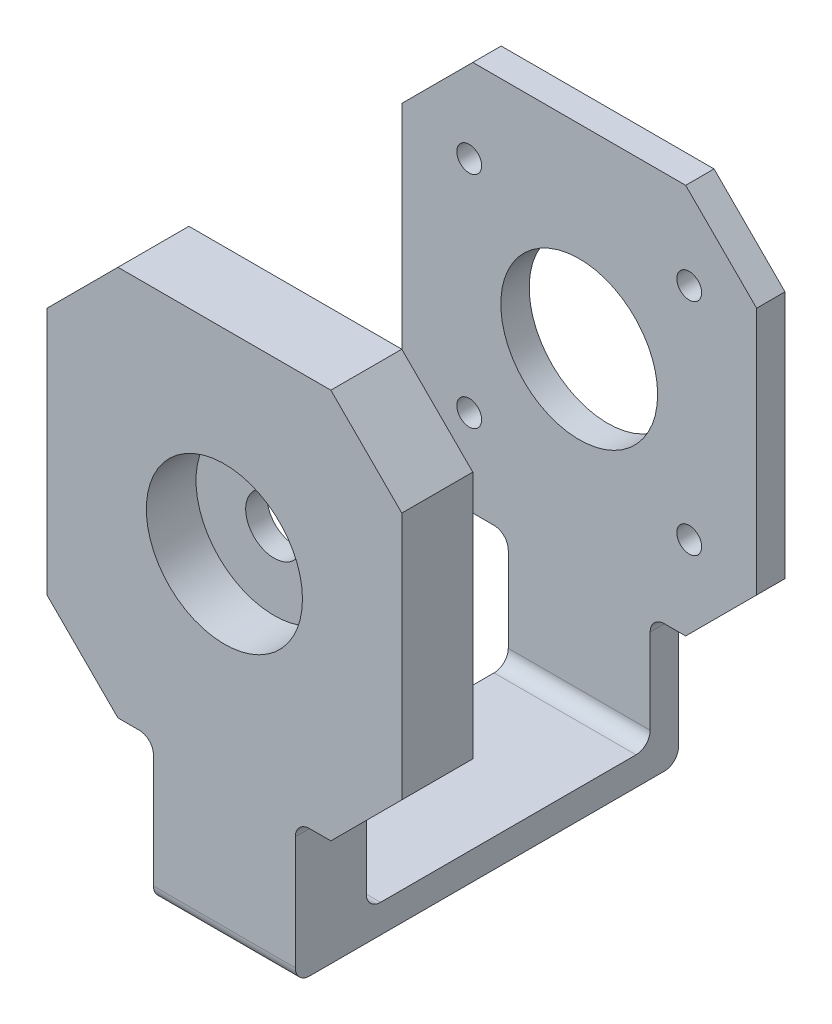
from build123d import *

# Parameters (mm, degrees)
SCHIZZO1_R                   = 1.75
SCHIZZO1_R_2                 = 11.05
ESTRUSIONE_ESTRUSIONE1_DEPTH = 4
SCHIZZO14_W                  = 20
SCHIZZO14_H                  = 4
ESTRUSIONE_ESTRUSIONE2_DEPTH = 40
ESTRUSIONE_ESTRUSIONE3_DEPTH = 10
SCHIZZO19_R                  = 11
TAGLIO_ESTRUSIONE1_DEPTH     = 7
SCHIZZO20_R                  = 4
TAGLIO_ESTRUSIONE2_DEPTH     = 7
SMUSSO1_SIZE                 = 10
RACCORDO1_R                  = 2


with BuildPart() as part:
    # Schizzo1 → Estrusione-Estrusione1 (new body)
    with BuildSketch(Plane.XY):
        Polygon((-25, -27.5), (-10, -27.5), (-10, -47.5), (10, -47.5), (10, -27.5), (25, -27.5), (25, 27.5), (-25, 27.5), align=None)
        with Locations((-15.5, 15.5)):
            Circle(SCHIZZO1_R, mode=Mode.SUBTRACT)
        with Locations((15.5, 15.5)):
            Circle(SCHIZZO1_R, mode=Mode.SUBTRACT)
        with Locations((15.5, -15.5)):
            Circle(SCHIZZO1_R, mode=Mode.SUBTRACT)
        with Locations((-15.5, -15.5)):
            Circle(SCHIZZO1_R, mode=Mode.SUBTRACT)
        Circle(SCHIZZO1_R_2, mode=Mode.SUBTRACT)
    extrude(amount=ESTRUSIONE_ESTRUSIONE1_DEPTH)

    # Schizzo14 → Estrusione-Estrusione2 (add)
    with BuildSketch(Plane.XY.offset(4)):
        with Locations((0, -45.5)):
            Rectangle(SCHIZZO14_W, SCHIZZO14_H)
    extrude(amount=ESTRUSIONE_ESTRUSIONE2_DEPTH)

    # Schizzo18 → Estrusione-Estrusione3 (add)
    with BuildSketch(Plane.XY.offset(44)):
        Polygon((-25, -27.5), (-10, -27.5), (-10, -47.5), (10, -47.5), (10, -27.5), (25, -27.5), (25, 27.5), (-25, 27.5), align=None)
    extrude(amount=ESTRUSIONE_ESTRUSIONE3_DEPTH)

    # Schizzo19 → Taglio-Estrusione1 (cut)
    with BuildSketch(Plane.XY.offset(54)):
        Circle(SCHIZZO19_R)
    extrude(amount=-TAGLIO_ESTRUSIONE1_DEPTH, mode=Mode.SUBTRACT)

    # Schizzo20 → Taglio-Estrusione2 (cut)
    with BuildSketch(Plane.XY.offset(47)):
        Circle(SCHIZZO20_R)
    extrude(amount=-TAGLIO_ESTRUSIONE2_DEPTH, mode=Mode.SUBTRACT)

    # Smusso1
    smusso1_edges = [part.edges().sort_by_distance(p)[0] for p in [
        (25, 27.5, 2),
        (25, -27.5, 2),
        (-25, -27.5, 2),
        (-25, 27.5, 2),
        (25, -27.5, 49),
        (-25, -27.5, 49),
        (-25, 27.5, 49),
        (25, 27.5, 49),
    ]]
    chamfer(smusso1_edges, length=SMUSSO1_SIZE)

    # Raccordo1
    raccordo1_edges = [part.edges().sort_by_distance(p)[0] for p in [
        (0, -47.5, 0),
        (-10, -27.5, 2),
        (10, -27.5, 2),
        (0, -43.5, 4),
        (0, -43.5, 44),
        (0, -47.5, 54),
        (-10, -27.5, 49),
        (10, -27.5, 49),
    ]]
    fillet(raccordo1_edges, radius=RACCORDO1_R)


solid = part.part
